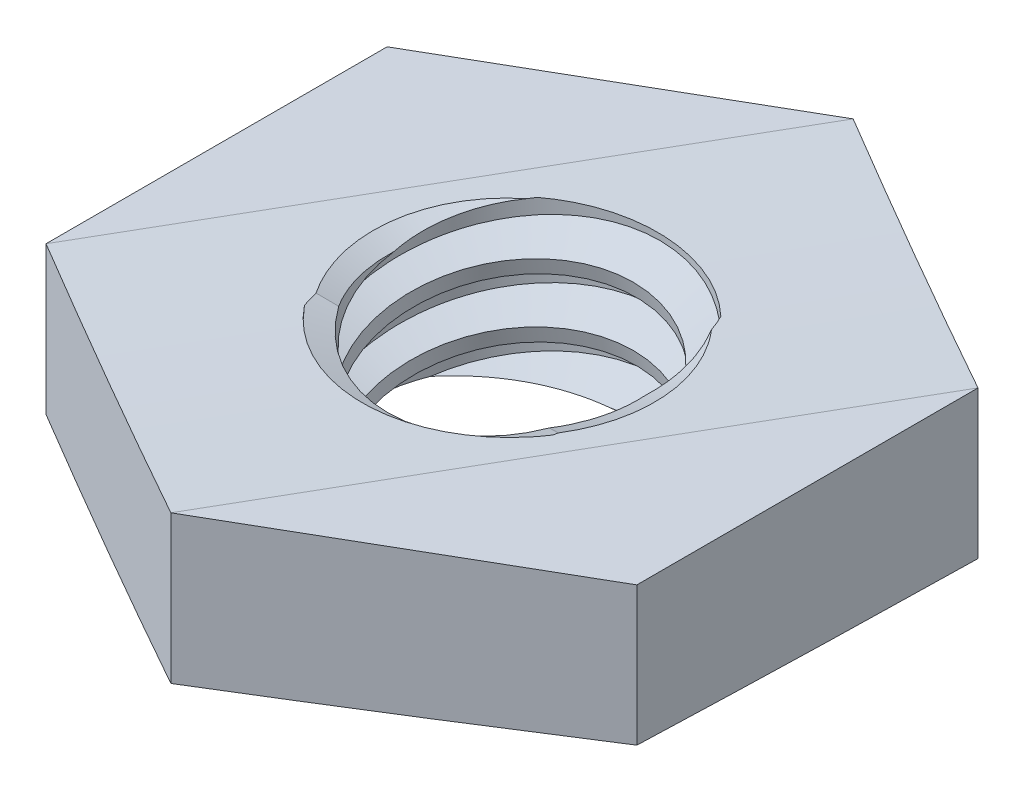
from build123d import *

# Parameters (mm, degrees)
EXTRUDE1_DEPTH       = 0.8
SKETCH2_W            = 1
SKETCH2_H            = 1.6
LPATTERN1_COUNT      = 4
LPATTERN1_PITCH      = 0.4
LPATTERN1_COUNT_DIR2 = 2
LPATTERN1_PITCH_DIR2 = 0.4
CUT_EXTRUDE1_DEPTH   = 10


with BuildPart() as part:
    # Sketch1 → Extrude1 (new, symmetric)
    with BuildSketch(Plane(origin=(0, 0, 0), x_dir=(1, 0, 0), z_dir=(0, 1, 0))):
        Polygon((0, 2.309401077), (-2, 1.154700538), (-2, -1.154700538), (0, -2.309401077), (2, -1.154700538), (2, 1.154700538), align=None)
    extrude(amount=EXTRUDE1_DEPTH, both=True)

    # Sketch4 → Cut-Revolve2 (revolve, cut)
    with BuildSketch(Plane(origin=(0, 0, 0), x_dir=(0, 0, -1), z_dir=(1, 0, 0))):
        Polygon((0, 0.8), (1, 0.8), (0.82201838, 0.717005807), (0.82201838, -0.717005807), (1, -0.8), (0, -0.8), align=None)
    revolve(axis=Axis((0, 0.8, 0), (0, 1, 0)), mode=Mode.SUBTRACT)


with BuildPart() as body_2:
    # Sketch2 → Revolve1 (revolve)
    with BuildSketch(Plane(origin=(0, 0, 0), x_dir=(0, 0, -1), z_dir=(1, 0, 0))):
        with Locations((0.5, 0)):
            Rectangle(SKETCH2_W, SKETCH2_H)
    revolve(axis=Axis((0, -1.8, 0), (0, 1, 0)))

    # Sketch3 → Cut-Revolve1 (revolve, cut)
    with BuildSketch(Plane(origin=(0, 0, 0), x_dir=(0, 0, -1), z_dir=(1, 0, 0))):
        Polygon((1.009805807, 0.750970966), (1.078446454, 0.40776773), (0.841629993, 0.487879925), (0.82201838, 0.585937993), align=None)
    cut_revolve1 = revolve(axis=Axis((0, 0.8, 0.085891176), (0, -0.9805806756909201, -0.19611613513818416)), mode=Mode.SUBTRACT)

    # LPattern1: Cut-Revolve1 4 × 2
    with Locations(*[Vector(0, -1, 0) * (i * LPATTERN1_PITCH) + Vector(0, 1, 0) * (j * LPATTERN1_PITCH_DIR2) for i in range(LPATTERN1_COUNT) for j in range(LPATTERN1_COUNT_DIR2) if (i, j) != (0, 0)]):
        add(cut_revolve1, mode=Mode.SUBTRACT)


with BuildPart() as part_1:
    add(part.part)

    # Combine1: cut body 2
    add(body_2.part, mode=Mode.SUBTRACT)

    # Sketch8 → Cut-Extrude1 (cut)
    with BuildSketch(Plane(origin=(1, 0, -1.732050808), x_dir=(-0.8660254037844387, 0, -0.49999999999999983), z_dir=(0.49999999999999983, 0, -0.8660254037844387))):
        with BuildLine():
            ThreePointArc((-9.370997107, 2.18202908), (0, 0.779159881), (9.370997107, 2.18202908))
            add(Edge.make_bspline(
                [(9.370997107, 2.18202908), (-0.379082197, 7.669320015), (-9.370997107, 2.18202908)],
                knots=[0, 0, 0, 1, 1, 1], degree=2))
        make_face()
        with BuildLine():
            ThreePointArc((-10.64516129, 1.54327441), (0, -0.220840119), (10.64516129, 1.54327441))
            add(Edge.make_bspline(
                [(10.64516129, 1.54327441), (-0.0817748, -7.501419358), (-10.64516129, 1.54327441)],
                knots=[0, 0, 0, 1, 1, 1], degree=2))
        make_face()
    extrude(amount=-CUT_EXTRUDE1_DEPTH, mode=Mode.SUBTRACT)


solid = part_1.part
